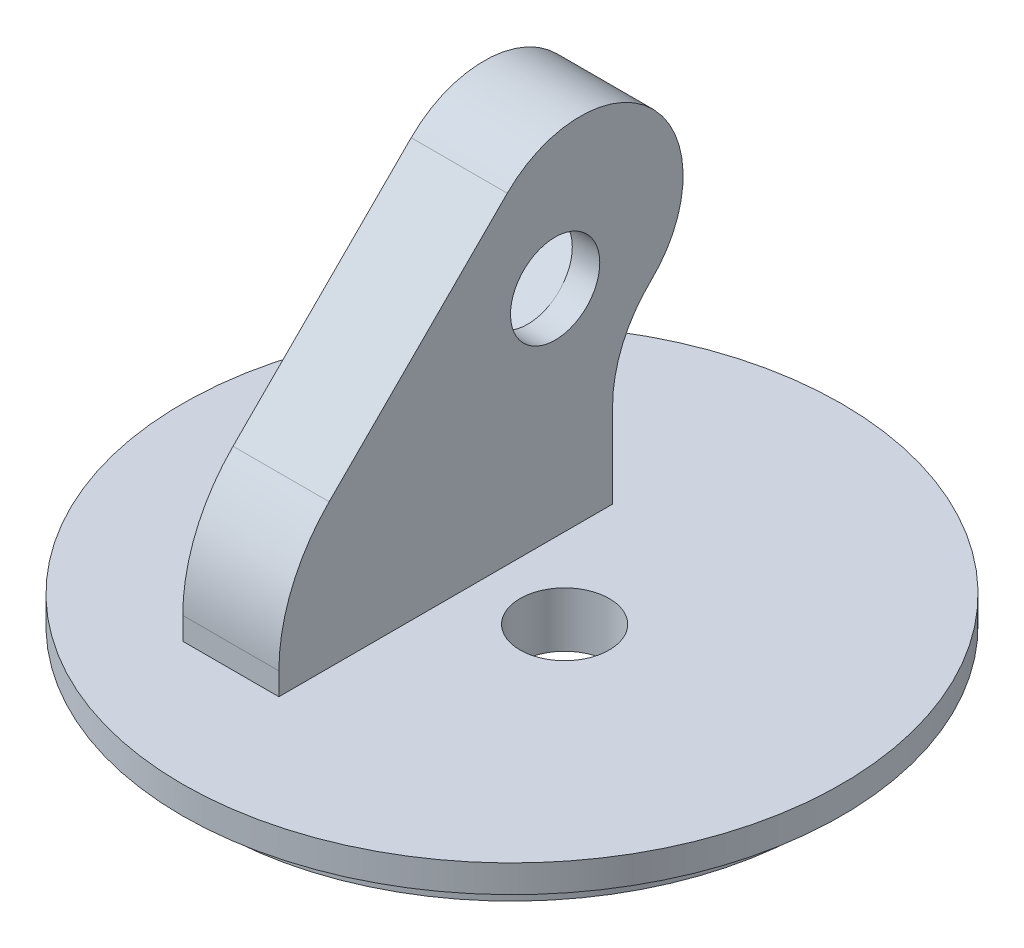
from build123d import *

# Parameters (mm, degrees)
SKETCH2_R           = 48
BOSS_EXTRUDE1_DEPTH = 4
BOSS_EXTRUDE2_DEPTH = 14
SKETCH31_R          = 6.5
CUT_EXTRUDE18_DEPTH = 96.977067922
CUT_EXTRUDE19_DEPTH = 10
SKETCH32_R          = 1
CUT_EXTRUDE20_DEPTH = 4.5
SKETCH33_R          = 43.5
BOSS_EXTRUDE3_DEPTH = 4
SKETCH35_R          = 6.5
CUT_EXTRUDE22_DEPTH = 86.072189458


with BuildPart() as part:
    # Sketch2 → Boss-Extrude1 (new body)
    with BuildSketch(Plane(origin=(0, 0, 0), x_dir=(1, 0, 0), z_dir=(0, 1, 0))):
        Circle(SKETCH2_R)
    extrude(amount=BOSS_EXTRUDE1_DEPTH)

    # Sketch7 → Boss-Extrude2 (add)
    with BuildSketch(Plane(origin=(-4, 0, 0), x_dir=(0, 0, -1), z_dir=(1, 0, 0))):
        with BuildLine():
            Line((18.652115716, 4), (18.652115716, 16.356133126))
            ThreePointArc((18.652115716, 16.356133126), (20.111216245, 23.455333411), (24.251965127, 29.403595153))
            ThreePointArc((24.251965127, 29.403595153), (24.659117989, 50.747356958), (3.311904584, 50.883081894))
            Line((3.311904584, 50.883081894), (-22.631121669, 24.94005564))
            ThreePointArc((-22.631121669, 24.94005564), (-28.050440452, 16.82947192), (-29.95345214, 7.262386111))
            Line((-29.95345214, 7.262386111), (-29.95345214, 4))
            Line((-29.95345214, 4), (18.652115716, 4))
        make_face()
    extrude(amount=-BOSS_EXTRUDE2_DEPTH)

    # Sketch31 → Cut-Extrude18 (cut, through all)
    with BuildSketch(Plane(origin=(-18, 10.461755651, -5.359516796), x_dir=(0, 0, 1), z_dir=(-1, 0, 0))):
        with Locations((-4.922469695, 24.905412087)):
            Circle(SKETCH31_R)
    extrude(amount=-CUT_EXTRUDE18_DEPTH, mode=Mode.SUBTRACT)

    # Sketch31<3> → Cut-Extrude19 (cut)
    with BuildSketch(Plane(origin=(-18, 10.461755651, -5.359516796), x_dir=(0, 0, 1), z_dir=(-1, 0, 0))):
        Polygon((-5.41546104, 34.054639751), (11.74960782, 18.74580534), (3.09678837, 9.043809897), (-14.06828049, 24.352644308), align=None)
    extrude(amount=-CUT_EXTRUDE19_DEPTH, mode=Mode.SUBTRACT)

    # Sketch32 → Cut-Extrude20 (cut)
    with BuildSketch(Plane.ZY.offset(18)):
        with Locations((-17.080620038, 41.264504586)):
            Circle(SKETCH32_R)
        with Locations((3.929449654, 22.692559529)):
            Circle(SKETCH32_R)
    extrude(amount=-CUT_EXTRUDE20_DEPTH, mode=Mode.SUBTRACT)

    # Sketch33 → Boss-Extrude3 (add)
    with BuildSketch(Plane.XZ):
        Circle(SKETCH33_R)
    extrude(amount=BOSS_EXTRUDE3_DEPTH)

    # Sketch35 → Cut-Extrude22 (cut, through all)
    with BuildSketch(Plane(origin=(0, 4, 0), x_dir=(1, 0, 0), z_dir=(0, 1, 0))):
        with Locations((7.665516898, 0)):
            Circle(SKETCH35_R)
    extrude(amount=-CUT_EXTRUDE22_DEPTH, mode=Mode.SUBTRACT)


solid = part.part
